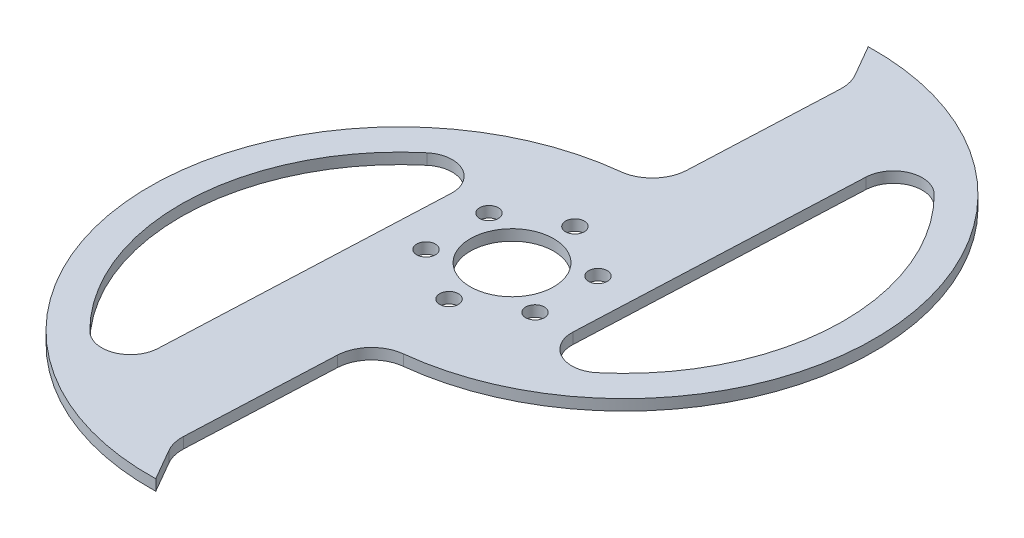
from build123d import *

# Parameters (mm, degrees)
BOSS_EXTRUDE1_DEPTH = 3.02
CIRPATTERN1_COUNT   = 2
SKETCH1_R           = 2.6
SKETCH1_R_2         = 11.6
CUT_EXTRUDE3_DEPTH  = 123.698767096
FILLET2_R           = 10


with BuildPart() as part:
    # Sketch2 → Boss-Extrude1 (new body)
    with BuildSketch(Plane(origin=(0, 0, 0), x_dir=(1, 0, 0), z_dir=(0, 1, 0))):
        with BuildLine():
            Line((-2.5, 101.569237469), (2.5, 92.908983431))
            ThreePointArc((2.5, 92.908983431), (3.553316941, 90.285228124), (3.830172933, 87.47152607))
            Line((3.830172933, 87.47152607), (1.490086628, 34.029834584))
            ThreePointArc((1.490086628, 34.029834584), (-0.76489004, 28.129878545), (-6.105878274, 24.758195623))
            ThreePointArc((-6.105878274, 24.758195623), (-25.375094257, -2.520831503), (-1.115516271, -25.475588775))
            Line((-1.115516271, -25.475588775), (-1.640465104, -37.46410114))
            ThreePointArc((-1.640465104, -37.46410114), (68.739343957, 32.490328651), (-2.5, 101.569237469))
        make_face()
        with BuildLine():
            Line((28.584477459, 69.883689844), (25.166013859, -8.185429513))
            ThreePointArc((25.166013859, -8.185429513), (29.613543301, -15.707166936), (38.290313437, -14.672414799))
            ThreePointArc((38.290313437, -14.672414799), (60.071901471, 29.395526481), (42.22555794, 75.198681923))
            ThreePointArc((42.22555794, 75.198681923), (33.672442411, 76.987890335), (28.584477459, 69.883689844))
        make_face(mode=Mode.SUBTRACT)
    extrude(amount=BOSS_EXTRUDE1_DEPTH)


with BuildPart() as cirpattern1_1:
    # CirPattern1: pattern copy
    add(part.part.rotate(Axis((0, -0.15, 0), (0, 1, 0)), 1 * 360 / CIRPATTERN1_COUNT))


with BuildPart() as part_1:
    add(part.part)

    # Combine1: union CirPattern1_1
    add(cirpattern1_1.part)

    # Sketch1 → Cut-Extrude3 (cut, through all)
    with BuildSketch(Plane(origin=(0, 0, 0), x_dir=(1, 0, 0), z_dir=(0, 1, 0))):
        with Locations((15.155444566, -8.75)):
            Circle(SKETCH1_R)
        with Locations((0, -17.5)):
            Circle(SKETCH1_R)
        with Locations((-15.155444566, -8.75)):
            Circle(SKETCH1_R)
        with Locations((-15.155444566, 8.75)):
            Circle(SKETCH1_R)
        with Locations((0, 17.5)):
            Circle(SKETCH1_R)
        with Locations((15.155444566, 8.75)):
            Circle(SKETCH1_R)
        Circle(SKETCH1_R_2)
    extrude(amount=CUT_EXTRUDE3_DEPTH, mode=Mode.SUBTRACT)

    # Fillet2
    fillet2_edges = [part_1.edges().sort_by_distance(p)[0] for p in [
        (-1.640465104, 1.51, 37.46410114),
        (1.640465104, 1.51, -37.46410114),
    ]]
    fillet(fillet2_edges, radius=FILLET2_R)


solid = part_1.part
